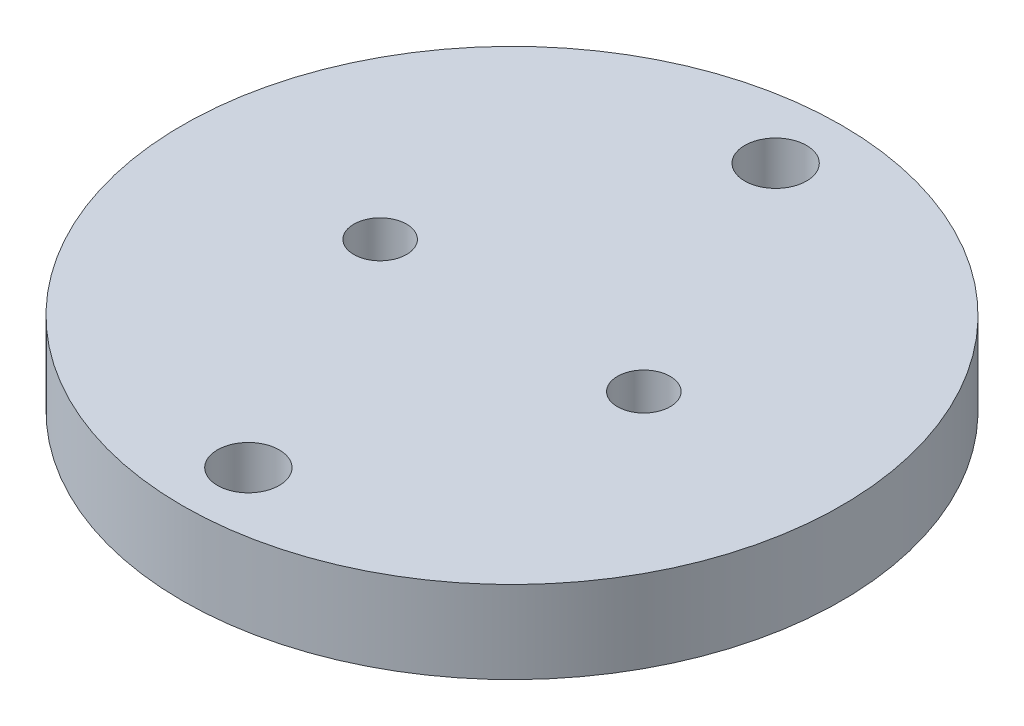
from build123d import *

# Parameters (mm, degrees)
SKETCH2_R           = 12.7
SKETCH2_R_2         = 1.190625
SKETCH2_R_3         = 1.016
BOSS_EXTRUDE1_DEPTH = 3.175


with BuildPart() as part:
    # Sketch2 → Boss-Extrude1 (new body)
    with BuildSketch(Plane(origin=(0, 0, 0), x_dir=(1, 0, 0), z_dir=(0, 1, 0))):
        Circle(SKETCH2_R)
        with Locations((0, 10.16)):
            Circle(SKETCH2_R_2, mode=Mode.SUBTRACT)
        with Locations((0, -10.16)):
            Circle(SKETCH2_R_2, mode=Mode.SUBTRACT)
        with Locations((5.08, 0)):
            Circle(SKETCH2_R_3, mode=Mode.SUBTRACT)
        with Locations((-5.08, 0)):
            Circle(SKETCH2_R_3, mode=Mode.SUBTRACT)
    extrude(amount=BOSS_EXTRUDE1_DEPTH)


solid = part.part
